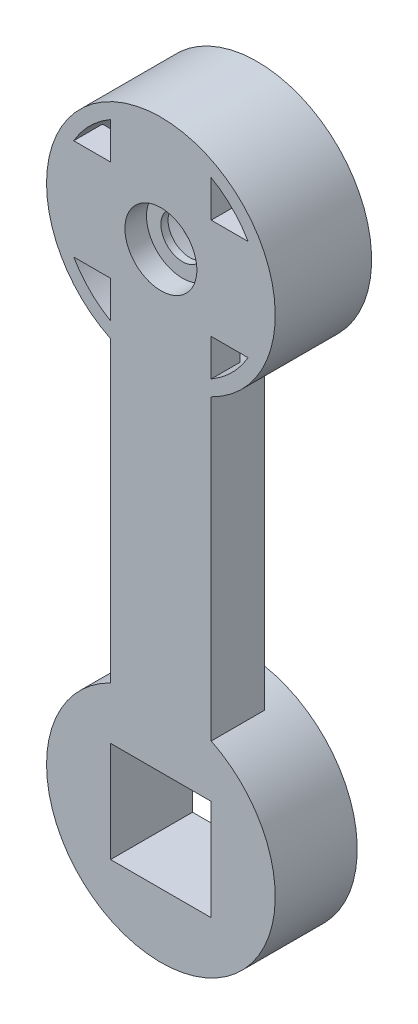
from build123d import *
from build123d.topology import SkipClean

# Parameters (mm, degrees)
SKETCH1_R            = 1.5
BOSS_EXTRUDE4_DEPTH  = 3
BOSS_EXTRUDE5_START  = 3
SKETCH3_R            = 7.95
SKETCH3_R_2          = 1.5
BOSS_EXTRUDE5_DEPTH  = 3
SKETCH4_R            = 2.5
CUT_EXTRUDE1_DEPTH   = 1.5
SKETCH5_R            = 7
CUT_EXTRUDE2_DEPTH   = 4
SKETCH6_R            = 7.95
CUT_EXTRUDE3_DEPTH   = 1
SKETCH7_R            = 2.5
CUT_EXTRUDE4_DEPTH   = 0.5
BOSS_EXTRUDE6_START  = 0.7
SKETCH8_R            = 7.95
SKETCH8_R_2          = 7
BOSS_EXTRUDE6_DEPTH  = 0.7
BOSS_EXTRUDE8_START  = 0.7
SKETCH9_R            = 7.95
SKETCH9_R_2          = 1.5
BOSS_EXTRUDE8_DEPTH  = 0.7
BOSS_EXTRUDE9_START  = 0.7
BOSS_EXTRUDE9_DEPTH  = 0.7
SKETCH15_R           = 7
SKETCH15_R_2         = 4.949747468
BOSS_EXTRUDE12_DEPTH = 5.7
SKETCH16_W           = 7
SKETCH16_H           = 7
CUT_EXTRUDE7_DEPTH   = 5.7


with BuildPart() as part:
    # Sketch1 → Boss-Extrude4 (new body)
    with BuildSketch(Plane.XY):
        with BuildLine():
            Line((-3.5, -7.138101989), (-3.5, -27.861898011))
            ThreePointArc((-3.5, -27.861898011), (0, -42.95), (3.5, -27.861898011))
            Line((3.5, -27.861898011), (3.5, -7.138101989))
            ThreePointArc((3.5, -7.138101989), (0, 7.95), (-3.5, -7.138101989))
        make_face()
        with BuildLine():
            Line((-3.5, 6.062177826), (-3.5, 3.5))
            Line((-3.5, 3.5), (-6.062177826, 3.5))
            ThreePointArc((-6.062177826, 3.5), (-4.949747468, 4.949747468), (-3.5, 6.062177826))
        make_face(mode=Mode.SUBTRACT)
        with BuildLine():
            Line((3.5, 3.5), (3.5, 6.062177826))
            ThreePointArc((3.5, 6.062177826), (4.949747468, 4.949747468), (6.062177826, 3.5))
            Line((6.062177826, 3.5), (3.5, 3.5))
        make_face(mode=Mode.SUBTRACT)
        Circle(SKETCH1_R, mode=Mode.SUBTRACT)
        with BuildLine():
            Line((-6.062177826, -3.5), (-3.5, -3.5))
            Line((-3.5, -3.5), (-3.5, -6.062177826))
            ThreePointArc((-3.5, -6.062177826), (-4.949747468, -4.949747468), (-6.062177826, -3.5))
        make_face(mode=Mode.SUBTRACT)
        with BuildLine():
            Line((3.5, -3.5), (6.062177826, -3.5))
            ThreePointArc((6.062177826, -3.5), (4.949747468, -4.949747468), (3.5, -6.062177826))
            Line((3.5, -6.062177826), (3.5, -3.5))
        make_face(mode=Mode.SUBTRACT)
        with BuildLine():
            ThreePointArc((3.5, -28.937822174), (4.949747468, -30.050252532), (6.062177826, -31.5))
            Line((6.062177826, -31.5), (3.5, -31.5))
            Line((3.5, -31.5), (3.5, -28.937822174))
        make_face(mode=Mode.SUBTRACT)
        with BuildLine():
            Line((-3.5, -28.937822174), (-3.5, -31.5))
            Line((-3.5, -31.5), (-6.062177826, -31.5))
            ThreePointArc((-6.062177826, -31.5), (-4.949747468, -30.050252532), (-3.5, -28.937822174))
        make_face(mode=Mode.SUBTRACT)
        with BuildLine():
            ThreePointArc((-3.5, -41.062177826), (-4.949747468, -39.949747468), (-6.062177826, -38.5))
            Line((-6.062177826, -38.5), (-3.5, -38.5))
            Line((-3.5, -38.5), (-3.5, -41.062177826))
        make_face(mode=Mode.SUBTRACT)
        with BuildLine():
            ThreePointArc((6.062177826, -38.5), (4.949747468, -39.949747468), (3.5, -41.062177826))
            Line((3.5, -41.062177826), (3.5, -38.5))
            Line((3.5, -38.5), (6.062177826, -38.5))
        make_face(mode=Mode.SUBTRACT)
        with Locations((0, -35)):
            Circle(SKETCH1_R, mode=Mode.SUBTRACT)
    extrude(amount=BOSS_EXTRUDE4_DEPTH)

    # Sketch3 → Boss-Extrude5 (add)
    # profile 1 of 2: a face of its own
    with SkipClean():  # the faces are left unmerged after this step: merging them gives an invalid solid
        with BuildSketch(Plane(origin=(0, 0, 0), x_dir=(-1, 0, 0), z_dir=(0, 0, -1)).offset(BOSS_EXTRUDE5_START)):
            Circle(SKETCH3_R)
            with BuildLine():
                Line((3.5, 3.5), (3.5, 6.062177826))
                ThreePointArc((3.5, 6.062177826), (4.949747468, 4.949747468), (6.062177826, 3.5))
                Line((6.062177826, 3.5), (3.5, 3.5))
            make_face(mode=Mode.SUBTRACT)
            with BuildLine():
                Line((3.5, -3.5), (6.062177826, -3.5))
                ThreePointArc((6.062177826, -3.5), (4.949747468, -4.949747468), (3.5, -6.062177826))
                Line((3.5, -6.062177826), (3.5, -3.5))
            make_face(mode=Mode.SUBTRACT)
            with BuildLine():
                Line((-3.5, -3.5), (-3.5, -6.062177826))
                ThreePointArc((-3.5, -6.062177826), (-4.949747468, -4.949747468), (-6.062177826, -3.5))
                Line((-6.062177826, -3.5), (-3.5, -3.5))
            make_face(mode=Mode.SUBTRACT)
            with BuildLine():
                Line((-3.5, 3.5), (-6.062177826, 3.5))
                ThreePointArc((-6.062177826, 3.5), (-4.949747468, 4.949747468), (-3.5, 6.062177826))
                Line((-3.5, 6.062177826), (-3.5, 3.5))
            make_face(mode=Mode.SUBTRACT)
            Circle(SKETCH3_R_2, mode=Mode.SUBTRACT)
        # profile 2 of 2: a face of its own
        with BuildSketch(Plane(origin=(0, 0, 0), x_dir=(-1, 0, 0), z_dir=(0, 0, -1)).offset(BOSS_EXTRUDE5_START)):
            with Locations((0, -35)):
                Circle(SKETCH3_R)
            with BuildLine():
                Line((-3.5, -38.5), (-3.5, -41.062177826))
                ThreePointArc((-3.5, -41.062177826), (-4.949747468, -39.949747468), (-6.062177826, -38.5))
                Line((-6.062177826, -38.5), (-3.5, -38.5))
            make_face(mode=Mode.SUBTRACT)
            with BuildLine():
                Line((-3.5, -31.5), (-6.062177826, -31.5))
                ThreePointArc((-6.062177826, -31.5), (-4.949747468, -30.050252532), (-3.5, -28.937822174))
                Line((-3.5, -28.937822174), (-3.5, -31.5))
            make_face(mode=Mode.SUBTRACT)
            with BuildLine():
                Line((3.5, -31.5), (3.5, -28.937822174))
                ThreePointArc((3.5, -28.937822174), (4.949747468, -30.050252532), (6.062177826, -31.5))
                Line((6.062177826, -31.5), (3.5, -31.5))
            make_face(mode=Mode.SUBTRACT)
            with BuildLine():
                Line((3.5, -38.5), (6.062177826, -38.5))
                ThreePointArc((6.062177826, -38.5), (4.949747468, -39.949747468), (3.5, -41.062177826))
                Line((3.5, -41.062177826), (3.5, -38.5))
            make_face(mode=Mode.SUBTRACT)
            with Locations((0, -35)):
                Circle(SKETCH3_R_2, mode=Mode.SUBTRACT)
        extrude(amount=-BOSS_EXTRUDE5_DEPTH)

    # Sketch4 → Cut-Extrude1 (cut)
    with SkipClean():  # the faces are left unmerged after this step: merging them gives an invalid solid
        with BuildSketch(Plane.XY.offset(3)):
            with Locations((0, -35)):
                Circle(SKETCH4_R)
            Circle(SKETCH4_R)
        extrude(amount=-CUT_EXTRUDE1_DEPTH, mode=Mode.SUBTRACT)

    # Sketch5 → Cut-Extrude2 (cut)
    with SkipClean():  # the faces are left unmerged after this step: merging them gives an invalid solid
        with BuildSketch(Plane(origin=(0, 0, -3), x_dir=(-1, 0, 0), z_dir=(0, 0, -1))):
            Circle(SKETCH5_R)
        extrude(amount=-CUT_EXTRUDE2_DEPTH, mode=Mode.SUBTRACT)
    add(part.part.scale(1), mode=Mode.REPLACE)  # the faces are merged on a copy

    # Sketch6 → Cut-Extrude3 (cut)
    with BuildSketch(Plane(origin=(0, 0, -3), x_dir=(-1, 0, 0), z_dir=(0, 0, -1))):
        with Locations((0, -35)):
            Circle(SKETCH6_R)
    extrude(amount=-CUT_EXTRUDE3_DEPTH, mode=Mode.SUBTRACT)

    # Sketch7 → Cut-Extrude4 (cut)
    with BuildSketch(Plane.XY.offset(1.5)):
        with Locations((0, -35)):
            Circle(SKETCH7_R)
    extrude(amount=-CUT_EXTRUDE4_DEPTH, mode=Mode.SUBTRACT)

    # Sketch8 → Boss-Extrude6 (add)
    with BuildSketch(Plane(origin=(0, 0, -3), x_dir=(-1, 0, 0), z_dir=(0, 0, -1)).offset(BOSS_EXTRUDE6_START)):
        Circle(SKETCH8_R)
        Circle(SKETCH8_R_2, mode=Mode.SUBTRACT)
    extrude(amount=-BOSS_EXTRUDE6_DEPTH)

    # Sketch9 → Boss-Extrude8 (add)
    with SkipClean():  # the faces are left unmerged after this step: merging them gives an invalid solid
        with BuildSketch(Plane(origin=(0, 0, -2), x_dir=(-1, 0, 0), z_dir=(0, 0, -1)).offset(BOSS_EXTRUDE8_START)):
            with Locations((0, -35)):
                Circle(SKETCH9_R)
            with BuildLine():
                Line((3.5, -31.5), (3.5, -28.937822174))
                ThreePointArc((3.5, -28.937822174), (4.949747468, -30.050252532), (6.062177826, -31.5))
                Line((6.062177826, -31.5), (3.5, -31.5))
            make_face(mode=Mode.SUBTRACT)
            with BuildLine():
                Line((3.5, -38.5), (6.062177826, -38.5))
                ThreePointArc((6.062177826, -38.5), (4.949747468, -39.949747468), (3.5, -41.062177826))
                Line((3.5, -41.062177826), (3.5, -38.5))
            make_face(mode=Mode.SUBTRACT)
            with BuildLine():
                Line((-3.5, -38.5), (-3.5, -41.062177826))
                ThreePointArc((-3.5, -41.062177826), (-4.949747468, -39.949747468), (-6.062177826, -38.5))
                Line((-6.062177826, -38.5), (-3.5, -38.5))
            make_face(mode=Mode.SUBTRACT)
            with BuildLine():
                Line((-3.5, -31.5), (-6.062177826, -31.5))
                ThreePointArc((-6.062177826, -31.5), (-4.949747468, -30.050252532), (-3.5, -28.937822174))
                Line((-3.5, -28.937822174), (-3.5, -31.5))
            make_face(mode=Mode.SUBTRACT)
            with Locations((0, -35)):
                Circle(SKETCH9_R_2, mode=Mode.SUBTRACT)
        extrude(amount=-BOSS_EXTRUDE8_DEPTH)

    # Sketch10 → Boss-Extrude9 (add)
    with SkipClean():  # the faces are left unmerged after this step: merging them gives an invalid solid
        with BuildSketch(Plane(origin=(0, 0, 0), x_dir=(-1, 0, 0), z_dir=(0, 0, -1)).offset(BOSS_EXTRUDE9_START)):
            with BuildLine():
                ThreePointArc((3.5, -7.138101989), (0, -7.95), (-3.5, -7.138101989))
                Line((-3.5, -7.138101989), (-3.5, -27.861898011))
                ThreePointArc((-3.5, -27.861898011), (0, -27.05), (3.5, -27.861898011))
                Line((3.5, -27.861898011), (3.5, -7.138101989))
            make_face()
        extrude(amount=-BOSS_EXTRUDE9_DEPTH)

    # Sketch15 → Boss-Extrude12 (add)
    with SkipClean():  # the faces are left unmerged after this step: merging them gives an invalid solid
        with BuildSketch(Plane(origin=(0, 0, -2.7), x_dir=(-1, 0, 0), z_dir=(0, 0, -1))):
            with Locations((0, -35)):
                Circle(SKETCH15_R)
            with Locations((0, -35)):
                Circle(SKETCH15_R_2, mode=Mode.SUBTRACT)
        extrude(amount=-BOSS_EXTRUDE12_DEPTH)

    # Sketch16 → Cut-Extrude7 (cut)
    with SkipClean():  # the faces are left unmerged after this step: merging them gives an invalid solid
        with BuildSketch(Plane(origin=(0, 0, -2.7), x_dir=(-1, 0, 0), z_dir=(0, 0, -1))):
            with Locations((0, -35)):
                Rectangle(SKETCH16_W, SKETCH16_H)
        extrude(amount=-CUT_EXTRUDE7_DEPTH, mode=Mode.SUBTRACT)


solid = part.part
